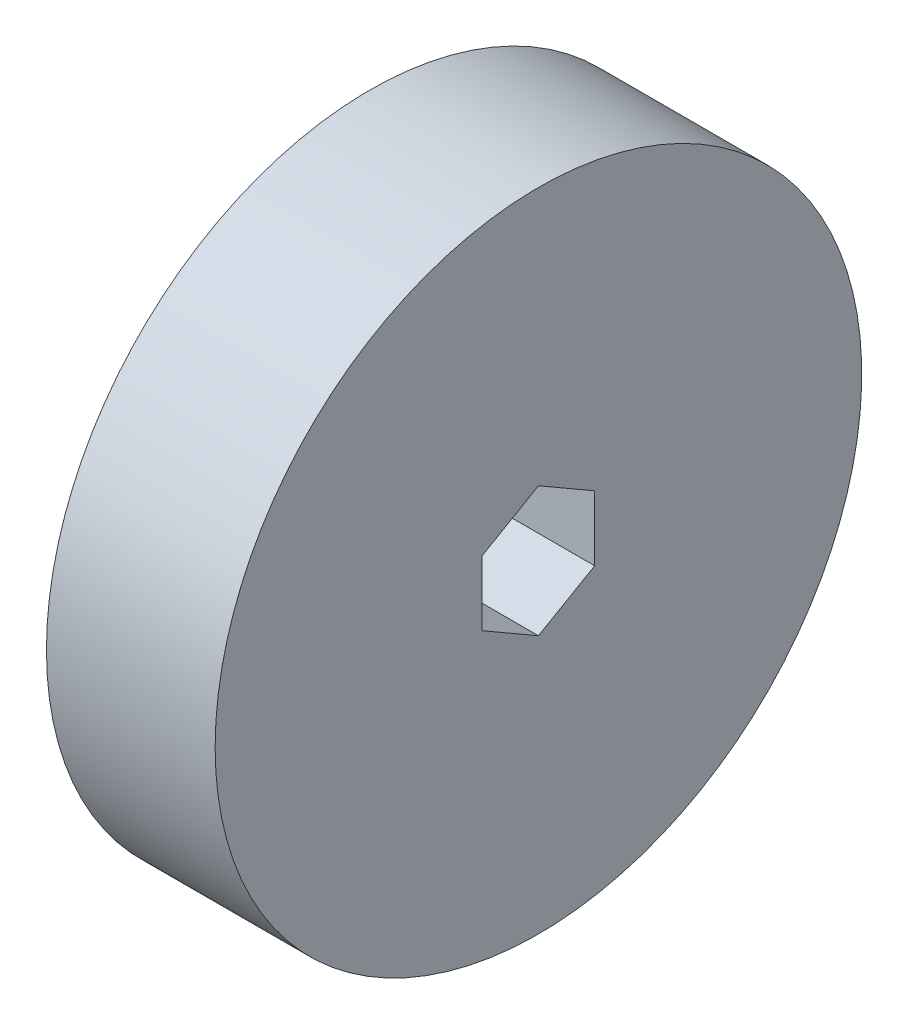
from build123d import *

# Parameters (mm, degrees)
SKETCH2_R           = 36.5125
BOSS_EXTRUDE1_DEPTH = 9.525


with BuildPart() as part:
    # Sketch2 → Boss-Extrude1 (new, symmetric)
    with BuildSketch(Plane(origin=(0, 0, 0), x_dir=(0, 0, -1), z_dir=(1, 0, 0))):
        Circle(SKETCH2_R)
        Polygon((0, 7.332348419), (-6.35, 3.666174209), (-6.35, -3.666174209), (0, -7.332348419), (6.35, -3.666174209), (6.35, 3.666174209), align=None, mode=Mode.SUBTRACT)
    extrude(amount=BOSS_EXTRUDE1_DEPTH, both=True)


solid = part.part
